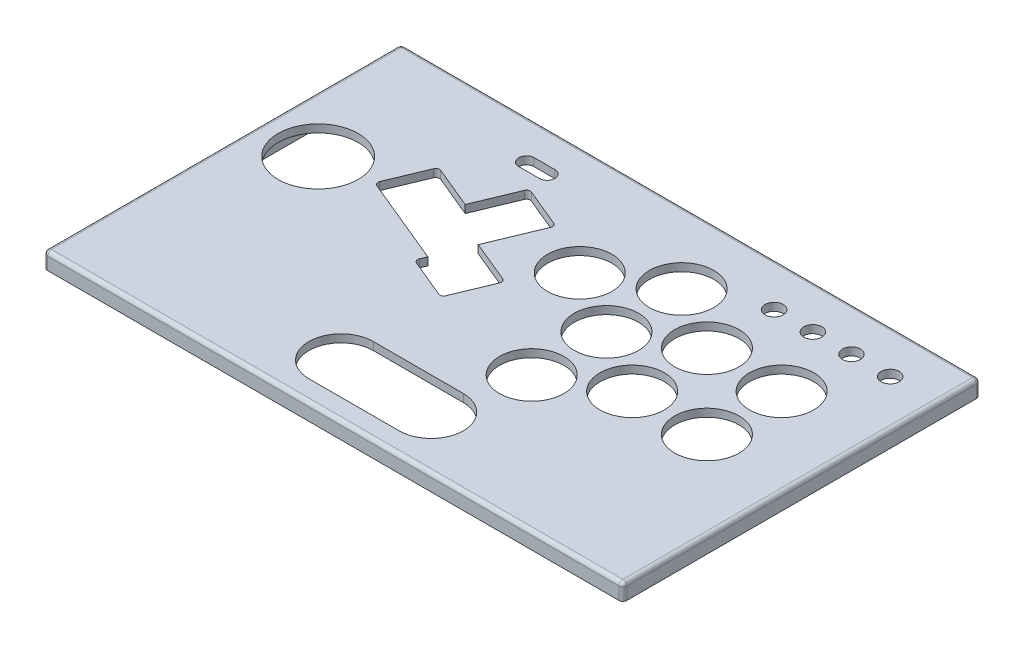
from build123d import *

# Parameters (mm, degrees)
SKETCH2_W                       = 224.807886448
SKETCH2_H                       = 138.699439424
TOP_PLATE_DEPTH                 = 6.35
PRIMARY_BUTTON_CUTOUTS_REACH    = 165.236
BUTTON_CUTOUTS_R                = 12.5
BUTTON_CUTOUTS_R_2              = 15.5
FILLET1_R                       = 1.5
SKETCH4_W                       = 212.807886448
SKETCH4_H                       = 126.699439424
CUT_EXTRUDE2_DEPTH              = 3.3
FILLET2_R                       = 1.5
SKETCH5_W                       = 35
SKETCH5_H                       = 6
CUT_EXTRUDE3_DEPTH              = 3
TAP_DRILL_FOR_M3X0_5_TAP1_D     = 2.5
TAP_DRILL_FOR_M3X0_5_TAP1_DEPTH = 4
TAP_DRILL_FOR_M3X0_5_TAP1_TIP   = 0.751075774
EXTRA_BUTTONS_REACH             = 165.236
SKETCH7_R                       = 3.5
LED_CUTOUT_REACH                = 165.236


with BuildPart() as part:
    # Sketch2 → top plate (new body)
    with BuildSketch(Plane(origin=(0, 0, 0), x_dir=(1, 0, 0), z_dir=(0, 1, 0))):
        with Locations((0, 48.849719712)):
            Rectangle(SKETCH2_W, SKETCH2_H)
    extrude(amount=TOP_PLATE_DEPTH)

    # Button Cutouts → primary button cutouts (cut, up to next)
    with BuildSketch(Plane(origin=(0, 0, 0), x_dir=(1, 0, 0), z_dir=(0, 1, 0)), mode=Mode.PRIVATE) as primary_button_cutouts_sk1:
        with Locations((24.5, 32)):
            Circle(BUTTON_CUTOUTS_R)
    primary_button_cutouts_tool1 = extrude(primary_button_cutouts_sk1.sketch, amount=PRIMARY_BUTTON_CUTOUTS_REACH, mode=Mode.PRIVATE) & part.part
    # Button Cutouts → primary button cutouts (cut, up to next)
    with BuildSketch(Plane(origin=(0, 0, 0), x_dir=(1, 0, 0), z_dir=(0, 1, 0)), mode=Mode.PRIVATE) as primary_button_cutouts_sk2:
        with Locations((24.5, 61)):
            Circle(BUTTON_CUTOUTS_R)
    primary_button_cutouts_tool2 = extrude(primary_button_cutouts_sk2.sketch, amount=PRIMARY_BUTTON_CUTOUTS_REACH, mode=Mode.PRIVATE) & part.part
    # Button Cutouts → primary button cutouts (cut, up to next)
    with BuildSketch(Plane(origin=(0, 0, 0), x_dir=(1, 0, 0), z_dir=(0, 1, 0)), mode=Mode.PRIVATE) as primary_button_cutouts_sk3:
        with Locations((49.5, 46)):
            Circle(BUTTON_CUTOUTS_R)
    primary_button_cutouts_tool3 = extrude(primary_button_cutouts_sk3.sketch, amount=PRIMARY_BUTTON_CUTOUTS_REACH, mode=Mode.PRIVATE) & part.part
    # Button Cutouts → primary button cutouts (cut, up to next)
    with BuildSketch(Plane(origin=(0, 0, 0), x_dir=(1, 0, 0), z_dir=(0, 1, 0)), mode=Mode.PRIVATE) as primary_button_cutouts_sk4:
        with Locations((49.5, 75)):
            Circle(BUTTON_CUTOUTS_R)
    primary_button_cutouts_tool4 = extrude(primary_button_cutouts_sk4.sketch, amount=PRIMARY_BUTTON_CUTOUTS_REACH, mode=Mode.PRIVATE) & part.part
    # Button Cutouts → primary button cutouts (cut, up to next)
    with BuildSketch(Plane(origin=(0, 0, 0), x_dir=(1, 0, 0), z_dir=(0, 1, 0)), mode=Mode.PRIVATE) as primary_button_cutouts_sk5:
        with Locations((78.5, 75)):
            Circle(BUTTON_CUTOUTS_R)
    primary_button_cutouts_tool5 = extrude(primary_button_cutouts_sk5.sketch, amount=PRIMARY_BUTTON_CUTOUTS_REACH, mode=Mode.PRIVATE) & part.part
    # Button Cutouts → primary button cutouts (cut, up to next)
    with BuildSketch(Plane(origin=(0, 0, 0), x_dir=(1, 0, 0), z_dir=(0, 1, 0)), mode=Mode.PRIVATE) as primary_button_cutouts_sk6:
        with Locations((78.5, 46)):
            Circle(BUTTON_CUTOUTS_R)
    primary_button_cutouts_tool6 = extrude(primary_button_cutouts_sk6.sketch, amount=PRIMARY_BUTTON_CUTOUTS_REACH, mode=Mode.PRIVATE) & part.part
    # Button Cutouts → primary button cutouts (cut, up to next)
    with BuildSketch(Plane(origin=(0, 0, 0), x_dir=(1, 0, 0), z_dir=(0, 1, 0)), mode=Mode.PRIVATE) as primary_button_cutouts_sk7:
        with Locations((-90.403943224, 64.008304483)):
            Circle(BUTTON_CUTOUTS_R_2)
    primary_button_cutouts_tool7 = extrude(primary_button_cutouts_sk7.sketch, amount=PRIMARY_BUTTON_CUTOUTS_REACH, mode=Mode.PRIVATE) & part.part
    # Button Cutouts → primary button cutouts (cut, up to next)
    with BuildSketch(Plane(origin=(0, 0, 0), x_dir=(1, 0, 0), z_dir=(0, 1, 0)), mode=Mode.PRIVATE) as primary_button_cutouts_sk8:
        with Locations((24.680313923, 89.999439424)):
            Circle(BUTTON_CUTOUTS_R)
    primary_button_cutouts_tool8 = extrude(primary_button_cutouts_sk8.sketch, amount=PRIMARY_BUTTON_CUTOUTS_REACH, mode=Mode.PRIVATE) & part.part
    # Button Cutouts → primary button cutouts (cut, up to next)
    with BuildSketch(Plane(origin=(0, 0, 0), x_dir=(1, 0, 0), z_dir=(0, 1, 0)), mode=Mode.PRIVATE) as primary_button_cutouts_sk9:
        with Locations((-0.524094275, 75.65587615)):
            Circle(BUTTON_CUTOUTS_R)
    primary_button_cutouts_tool9 = extrude(primary_button_cutouts_sk9.sketch, amount=PRIMARY_BUTTON_CUTOUTS_REACH, mode=Mode.PRIVATE) & part.part
    # Button Cutouts → primary button cutouts (cut, up to next)
    with BuildSketch(Plane(origin=(0, 0, 0), x_dir=(1, 0, 0), z_dir=(0, 1, 0)), mode=Mode.PRIVATE) as primary_button_cutouts_sk10:
        with BuildLine():
            Line((17.5, -12.5), (-17.5, -12.5))
            ThreePointArc((-17.5, -12.5), (-30, 0), (-17.5, 12.5))
            Line((-17.5, 12.5), (17.5, 12.5))
            ThreePointArc((17.5, 12.5), (30, 0), (17.5, -12.5))
        make_face()
    primary_button_cutouts_tool10 = extrude(primary_button_cutouts_sk10.sketch, amount=PRIMARY_BUTTON_CUTOUTS_REACH, mode=Mode.PRIVATE) & part.part
    # Button Cutouts → primary button cutouts (cut, up to next)
    with BuildSketch(Plane(origin=(0, 0, 0), x_dir=(1, 0, 0), z_dir=(0, 1, 0)), mode=Mode.PRIVATE) as primary_button_cutouts_sk11:
        Polygon((-70.581424626, 66.134393952), (-63.310439411, 83.688105069), (-45.710534316, 76.397985683), (-38.42041493, 93.997890777), (-20.866703812, 86.726905562), (-29.687556928, 65.431482338), (-12.087651834, 58.141362951), (-19.358637049, 40.587651834), (-36.912348166, 47.858637049), (-35.381614437, 51.554155179), align=None)
    primary_button_cutouts_tool11 = extrude(primary_button_cutouts_sk11.sketch, amount=PRIMARY_BUTTON_CUTOUTS_REACH, mode=Mode.PRIVATE) & part.part
    add(primary_button_cutouts_tool1.solids().sort_by_distance((24.5, 0, -32))[0], mode=Mode.SUBTRACT)
    add(primary_button_cutouts_tool2.solids().sort_by_distance((24.5, 0, -61))[0], mode=Mode.SUBTRACT)
    add(primary_button_cutouts_tool3.solids().sort_by_distance((49.5, 0, -46))[0], mode=Mode.SUBTRACT)
    add(primary_button_cutouts_tool4.solids().sort_by_distance((49.5, 0, -75))[0], mode=Mode.SUBTRACT)
    add(primary_button_cutouts_tool5.solids().sort_by_distance((78.5, 0, -75))[0], mode=Mode.SUBTRACT)
    add(primary_button_cutouts_tool6.solids().sort_by_distance((78.5, 0, -46))[0], mode=Mode.SUBTRACT)
    add(primary_button_cutouts_tool7.solids().sort_by_distance((-90.403943, 0, -64.008304))[0], mode=Mode.SUBTRACT)
    add(primary_button_cutouts_tool8.solids().sort_by_distance((24.680314, 0, -89.999439))[0], mode=Mode.SUBTRACT)
    add(primary_button_cutouts_tool9.solids().sort_by_distance((-0.524094, 0, -75.655876))[0], mode=Mode.SUBTRACT)
    add(primary_button_cutouts_tool10.solids().sort_by_distance((0, 0, 0))[0], mode=Mode.SUBTRACT)
    add(primary_button_cutouts_tool11.solids().sort_by_distance((-39.131182, 0, -67.460691))[0], mode=Mode.SUBTRACT)

    # Fillet1
    fillet1_edges = [part.edges().sort_by_distance(p)[0] for p in [
        (-20.866703812, 3.175, -86.726905562),
        (-12.087651834, 3.175, -58.141362951),
        (-19.358637049, 3.175, -40.587651834),
        (-36.912348166, 3.175, -47.858637049),
        (-70.581424626, 3.175, -66.134393952),
        (-63.310439411, 3.175, -83.688105069),
        (-38.42041493, 3.175, -93.997890777),
    ]]
    fillet(fillet1_edges, radius=FILLET1_R)

    # Sketch4 → Cut-Extrude2 (cut)
    with BuildSketch(Plane.XZ):
        with Locations((0, -48.849719712)):
            Rectangle(SKETCH4_W, SKETCH4_H)
    extrude(amount=-CUT_EXTRUDE2_DEPTH, mode=Mode.SUBTRACT)

    # Fillet2
    fillet2_edges = [part.edges().sort_by_distance(p)[0] for p in [
        (112.403943224, 3.175, -118.199439424),
        (-112.403943224, 3.175, -118.199439424),
        (-112.403943224, 3.175, 20.5),
        (112.403943224, 3.175, 20.5),
        (112.403943224, 6.35, -48.849719712),
        (0, 6.35, -118.199439424),
        (0, 6.35, 20.5),
        (-112.403943224, 6.35, -48.849719712),
    ]]
    fillet(fillet2_edges, radius=FILLET2_R)

    # Sketch5 → Cut-Extrude3 (cut)
    with BuildSketch(Plane.XZ):
        with Locations((-73.903943224, -115.199439424)):
            Rectangle(SKETCH5_W, SKETCH5_H)
    extrude(amount=-CUT_EXTRUDE3_DEPTH, mode=Mode.SUBTRACT)

    # Tap Drill for M3x0.5 Tap1
    with Locations(Plane(origin=(-108.403943224, 0, 16.5), x_dir=(0, 0, -1), z_dir=(0, -1, 0))):
        with Locations((0, 0), (130.699439424, 0), (130.699439424, 216.807886448), (0, 216.807886448)):
            Hole(TAP_DRILL_FOR_M3X0_5_TAP1_D / 2, depth=TAP_DRILL_FOR_M3X0_5_TAP1_DEPTH)
            with Locations((0, 0, -(TAP_DRILL_FOR_M3X0_5_TAP1_DEPTH + TAP_DRILL_FOR_M3X0_5_TAP1_TIP / 2))):  # 118° drill point
                Cone(0, TAP_DRILL_FOR_M3X0_5_TAP1_D / 2, TAP_DRILL_FOR_M3X0_5_TAP1_TIP, mode=Mode.SUBTRACT)

    # Sketch7 → extra_buttons (cut, up to next)
    with BuildSketch(Plane(origin=(0, 6.35, 0), x_dir=(1, 0, 0), z_dir=(0, 1, 0)), mode=Mode.PRIVATE) as extra_buttons_sk1:
        with Locations((49.592739038, 101.007512208)):
            Circle(SKETCH7_R)
    extra_buttons_tool1 = extrude(extra_buttons_sk1.sketch, amount=-EXTRA_BUTTONS_REACH, mode=Mode.PRIVATE) & part.part
    # Sketch7 → extra_buttons (cut, up to next)
    with BuildSketch(Plane(origin=(0, 6.35, 0), x_dir=(1, 0, 0), z_dir=(0, 1, 0)), mode=Mode.PRIVATE) as extra_buttons_sk2:
        with Locations((64.592738357, 101.012034821)):
            Circle(SKETCH7_R)
    extra_buttons_tool2 = extrude(extra_buttons_sk2.sketch, amount=-EXTRA_BUTTONS_REACH, mode=Mode.PRIVATE) & part.part
    # Sketch7 → extra_buttons (cut, up to next)
    with BuildSketch(Plane(origin=(0, 6.35, 0), x_dir=(1, 0, 0), z_dir=(0, 1, 0)), mode=Mode.PRIVATE) as extra_buttons_sk3:
        with Locations((79.592737675, 101.016557433)):
            Circle(SKETCH7_R)
    extra_buttons_tool3 = extrude(extra_buttons_sk3.sketch, amount=-EXTRA_BUTTONS_REACH, mode=Mode.PRIVATE) & part.part
    # Sketch7 → extra_buttons (cut, up to next)
    with BuildSketch(Plane(origin=(0, 6.35, 0), x_dir=(1, 0, 0), z_dir=(0, 1, 0)), mode=Mode.PRIVATE) as extra_buttons_sk4:
        with Locations((94.592736993, 101.021080046)):
            Circle(SKETCH7_R)
    extra_buttons_tool4 = extrude(extra_buttons_sk4.sketch, amount=-EXTRA_BUTTONS_REACH, mode=Mode.PRIVATE) & part.part
    add(extra_buttons_tool1.solids().sort_by_distance((49.592739, 6.35, -101.007512))[0], mode=Mode.SUBTRACT)
    add(extra_buttons_tool2.solids().sort_by_distance((64.592738, 6.35, -101.012035))[0], mode=Mode.SUBTRACT)
    add(extra_buttons_tool3.solids().sort_by_distance((79.592738, 6.35, -101.016557))[0], mode=Mode.SUBTRACT)
    add(extra_buttons_tool4.solids().sort_by_distance((94.592737, 6.35, -101.02108))[0], mode=Mode.SUBTRACT)

    # Sketch8 → led_cutout (cut, up to next)
    with BuildSketch(Plane(origin=(0, 6.35, 0), x_dir=(1, 0, 0), z_dir=(0, 1, 0)), mode=Mode.PRIVATE) as led_cutout_sk1:
        with BuildLine():
            Line((-48.062495753, 105.533619334), (-40.062495753, 105.533619334))
            ThreePointArc((-40.062495753, 105.533619334), (-37.062495753, 102.533619334), (-40.062495753, 99.533619334))
            Line((-40.062495753, 99.533619334), (-48.062495753, 99.533619334))
            ThreePointArc((-48.062495753, 99.533619334), (-51.062495753, 102.533619334), (-48.062495753, 105.533619334))
        make_face()
    led_cutout_tool1 = extrude(led_cutout_sk1.sketch, amount=-LED_CUTOUT_REACH, mode=Mode.PRIVATE) & part.part
    add(led_cutout_tool1.solids().sort_by_distance((-44.062496, 6.35, -102.533619))[0], mode=Mode.SUBTRACT)


solid = part.part
